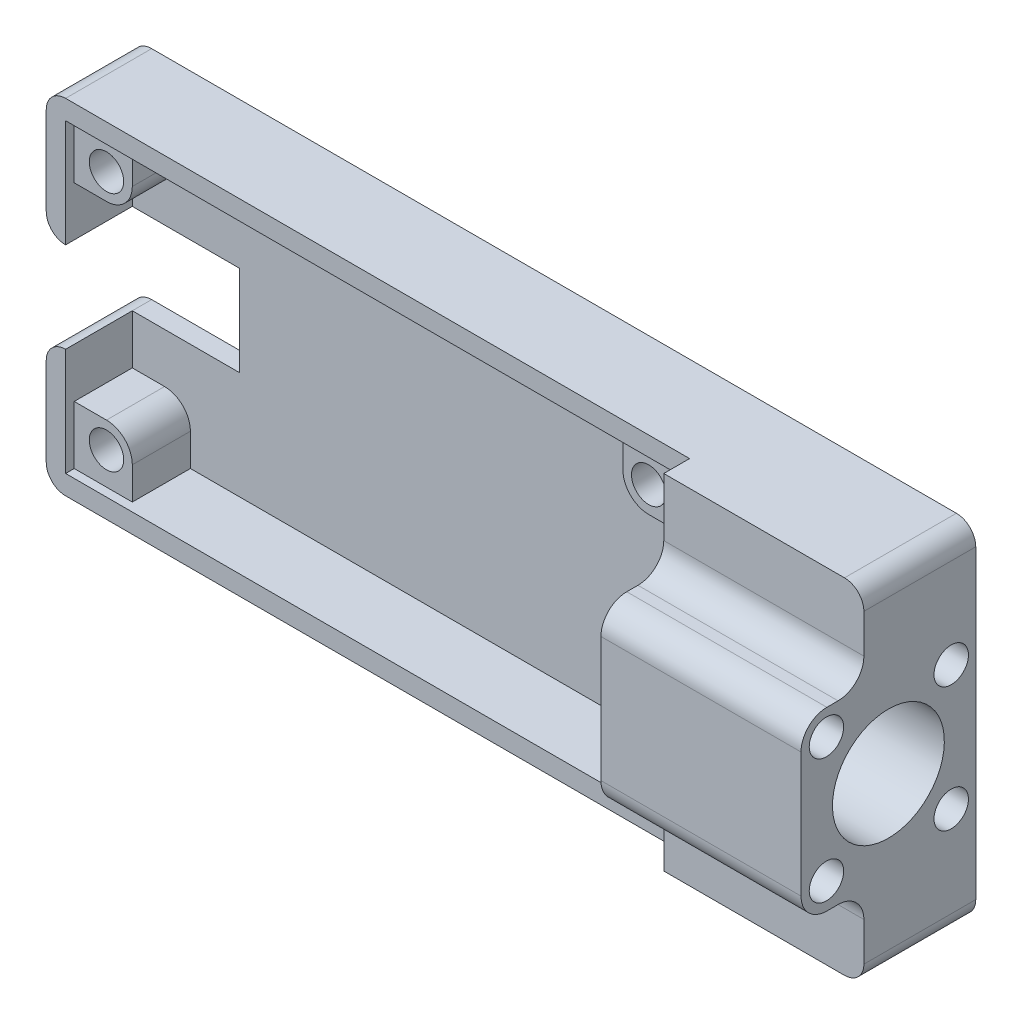
from build123d import *

# Parameters (mm, degrees)
BODY_DEPTH          = 10
PCB_RECESS_DEPTH    = 7.75
SKETCH11_R          = 3.000000000000004
SKETCH11_R_2        = 2.999999999999999
SKETCH11_R_3        = 3.000000000000008
SKETCH11_R_4        = 3.0000000000000084
PCB_BOSS_DEPTH      = 6.75
FILLET2_R           = 2.25
BOSS_EXTRUDE2_DEPTH = 23.25
BOSS_EXTRUDE3_DEPTH = 3
SKETCH25_R          = 6.5
CUT_EXTRUDE9_DEPTH  = 15
CUT_EXTRUDE10_DEPTH = 10.25
FILLET7_R           = 3
FILLET8_R           = 2.25
SKETCH27_R          = 2.0000000000000067
SKETCH27_R_2        = 2.000000000000003
SKETCH27_R_3        = 2
SKETCH27_R_4        = 1.9999999999999996
CUT_EXTRUDE11_DEPTH = 5.5
SKETCH12_R          = 1.9999999999999991
SKETCH12_R_2        = 1.9999999999999967
SKETCH12_R_3        = 1.9999999999999996
CUT_EXTRUDE5_DEPTH  = 4.5


with BuildPart() as part:
    # Sketch4 → body (new body)
    with BuildSketch(Plane.XY):
        Polygon((0, 40), (1.73e-15, 25.25), (14.7, 25.25), (14.7, 14.750000000000002), (0, 14.75), (0, 0), (97.99999999999999, 6.94e-15), (98, 40.00000000000001), align=None)
    extrude(amount=BODY_DEPTH)

    # Sketch10 → pcb-recess (cut)
    with BuildSketch(Plane.XY.offset(10)):
        Polygon((72.75000000000001, 2.250000000000009), (2.2500000000000018, 2.2500000000000004), (2.2500000000000044, 37.74999999999999), (72.75, 37.75000000000001), align=None)
    extrude(amount=-PCB_RECESS_DEPTH, mode=Mode.SUBTRACT)

    # Sketch11 → pcb-boss (add)
    with BuildSketch(Plane.XY.offset(2.25)):
        with Locations((6.000000000000004, 34)):
            Circle(SKETCH11_R)
        with BuildLine():
            Line((2.250000000000004, 31), (6.000000000000004, 31))
            ThreePointArc((6.0000000000000036, 30.999999999999996), (3.8786796564403594, 36.121320343559645), (9.000000000000009, 34))
            Line((9.000000000000007, 34), (9.000000000000007, 37.74999999999999))
            Line((9.000000000000007, 37.74999999999999), (2.2500000000000044, 37.74999999999999))
            Line((2.2500000000000044, 37.74999999999999), (2.250000000000004, 31))
        make_face()
        with BuildLine():
            Line((2.2500000000000018, 2.2500000000000004), (9.000000000000007, 2.2500000000000013))
            Line((9.000000000000007, 2.2500000000000013), (9.000000000000007, 6.000000000000005))
            ThreePointArc((9.000000000000007, 6.000000000000004), (3.8786796564403647, 3.8786796564403634), (6.000000000000007, 9.000000000000004))
            Line((6.000000000000007, 9.000000000000005), (2.250000000000002, 9.000000000000014))
            Line((2.250000000000002, 9.000000000000014), (2.2500000000000018, 2.25))
        make_face()
        with Locations((6.000000000000007, 6.000000000000005)):
            Circle(SKETCH11_R_2)
        with Locations((69, 6.000000000000005)):
            Circle(SKETCH11_R_3)
        with BuildLine():
            Line((72.75000000000001, 2.250000000000009), (72.75000000000001, 9.000000000000012))
            Line((72.75000000000001, 9.000000000000012), (69, 9.000000000000012))
            ThreePointArc((69, 9.000000000000014), (71.12132034355965, 8.121320343559653), (72.00000000000001, 6.000000000000005))
            ThreePointArc((72.00000000000001, 6.000000000000004), (69, 2.9999999999999973), (65.99999999999999, 6.000000000000005))
            Line((66, 6.000000000000005), (66, 2.250000000000008))
            Line((66, 2.250000000000008), (72.75000000000001, 2.250000000000009))
        make_face()
        with BuildLine():
            Line((72.75, 37.75000000000001), (66, 37.75000000000001))
            Line((66, 37.75000000000001), (66, 34))
            ThreePointArc((65.99999999999999, 34), (69, 37.00000000000001), (72.00000000000001, 34))
            ThreePointArc((72.00000000000001, 34), (71.12132034355965, 31.87867965644035), (69, 30.999999999999993))
            Line((69, 30.999999999999993), (72.75, 30.999999999999993))
            Line((72.75, 30.999999999999993), (72.75, 37.75000000000001))
        make_face()
        with Locations((69, 34)):
            Circle(SKETCH11_R_4)
    extrude(amount=PCB_BOSS_DEPTH)

    # Fillet2
    fillet2_edges = [part.edges().sort_by_distance(p)[0] for p in [
        (0, 14.75, 5),
        (1.73e-15, 25.25, 5),
    ]]
    fillet(fillet2_edges, radius=FILLET2_R - 0.0001)  # a hair under: the kernel refuses the full size

    # Sketch23 → Boss-Extrude2 (add)
    with BuildSketch(Plane(origin=(97.99999999999999, -3.4e-14, 0), x_dir=(0, 0, -1), z_dir=(1, -3.5e-16, 0))):
        Polygon((-10, 30.250000000000025), (-20.299999999999997, 30.25000000000003), (-20.299999999999994, 9.750000000000027), (-9.999999999999998, 9.75000000000002), align=None)
    extrude(amount=-BOSS_EXTRUDE2_DEPTH)

    # Sketch24 → Boss-Extrude3 (add)
    with BuildSketch(Plane.XY.offset(10)):
        Polygon((74.75, 30.25), (98, 30.25), (98, 40.00000000000001), (74.75, 39.99999999999999), align=None)
        Polygon((74.75000000000001, 9.749999999999995), (97.99999999999999, 9.749999999999995), (97.99999999999999, 6.94e-15), (74.75000000000001, -6.94e-15), align=None)
    extrude(amount=BOSS_EXTRUDE3_DEPTH)

    # Sketch25 → Cut-Extrude9 (cut)
    with BuildSketch(Plane(origin=(97.99999999999999, -3.4e-14, 0), x_dir=(0, 0, -1), z_dir=(1, -3.5e-16, 0))):
        with Locations(Location((-10.149999999999999, 20.000000000000025, 0), (0, 0, 90))):
            Circle(SKETCH25_R)
    extrude(amount=-CUT_EXTRUDE9_DEPTH, mode=Mode.SUBTRACT)

    # Sketch26 → Cut-Extrude10 (cut)
    with BuildSketch(Plane(origin=(83, -2.88e-14, 0), x_dir=(0, 0, -1), z_dir=(1, -3.5e-16, 0))):
        with BuildLine():
            Line((-10.149999999999999, 26.500000000000025), (-10.149999999999999, 13.500000000000027))
            ThreePointArc((-10.149999999999999, 13.500000000000027), (-3.6499999999999986, 20.000000000000025), (-10.149999999999999, 26.500000000000025))
        make_face()
    extrude(amount=-CUT_EXTRUDE10_DEPTH, mode=Mode.SUBTRACT)

    # Fillet7
    fillet7_edges = [part.edges().sort_by_distance(p)[0] for p in [
        (86.37499999999999, 9.749999999999996, 20.299999999999994),
        (86.375, 30.249999999999996, 20.299999999999997),
        (86.375, 30.25, 13),
        (86.375, 9.749999999999995, 13),
    ]]
    fillet(fillet7_edges, radius=FILLET7_R)

    # Fillet8
    fillet8_edges = [part.edges().sort_by_distance(p)[0] for p in [
        (0, 40, 5),
        (98, 40.00000000000001, 6.5),
        (97.99999999999999, 6.94e-15, 6.5),
        (0, 0, 5),
    ]]
    fillet(fillet8_edges, radius=FILLET8_R)

    # Sketch27 → Cut-Extrude11 (cut)
    with BuildSketch(Plane(origin=(97.99999999999999, -3.4e-14, 0), x_dir=(0, 0, -1), z_dir=(1, -3.5e-16, 0))):
        with Locations(Location((-17.350000000000005, 27.300000000000026, 0), (0, 0, 90))):
            Circle(SKETCH27_R)
        with Locations(Location((-2.850000000000002, 27.300000000000026, 0), (0, 0, 90))):
            Circle(SKETCH27_R_2)
        with Locations(Location((-2.8499999999999948, 12.800000000000026, 0), (0, 0, 90))):
            Circle(SKETCH27_R_3)
        with Locations(Location((-17.349999999999998, 12.800000000000026, 0), (0, 0, 90))):
            Circle(SKETCH27_R_4)
    extrude(amount=-CUT_EXTRUDE11_DEPTH, mode=Mode.SUBTRACT)

    # Sketch12 → Cut-Extrude5 (cut)
    with BuildSketch(Plane.XY.offset(9.000000000000002)):
        with Locations((6.000000000000004, 34)):
            Circle(SKETCH12_R)
        with Locations((69, 34)):
            Circle(SKETCH12_R_2)
        with Locations((69, 6.000000000000005)):
            Circle(SKETCH12_R_2)
        with Locations((6.000000000000007, 6.000000000000005)):
            Circle(SKETCH12_R_3)
    extrude(amount=-CUT_EXTRUDE5_DEPTH, mode=Mode.SUBTRACT)


solid = part.part
